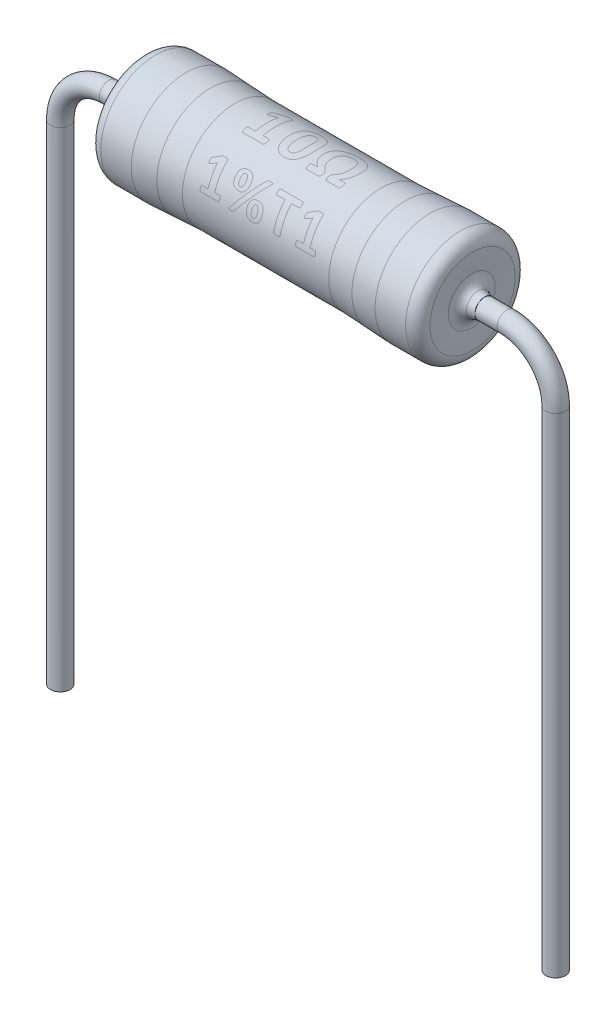
from build123d import *

# Parameters (mm, degrees)
SKETCH_WIRE_DIAMETER_R = 0.4
FILLET1_R              = 0.5
FILLET2_R              = 0.5


with BuildPart() as part:
    # SET WIRE LENGTH: sweep along a path in Sketch Wire Length
    with BuildLine(Plane.XY) as set_wire_length_path:
        Line((10.16, -22.048407346), (10.16, -2))
        ThreePointArc((10.16, -2), (9.574213562, -0.585786438), (8.16, 0))
        Line((8.16, 0), (-8.16, 0))
        ThreePointArc((-8.16, 0), (-9.574213562, -0.585786438), (-10.16, -2))
        Line((-10.16, -2), (-10.16, -22.048407346))
    # Sketch Wire Diameter → SET WIRE LENGTH (sweep)
    with BuildSketch(Plane(origin=(0, 0, 0), x_dir=(0, 0, -1), z_dir=(1, 0, 0))):
        Circle(SKETCH_WIRE_DIAMETER_R)
    sweep(path=set_wire_length_path.line)


with BuildPart() as body_2:
    # Sketch4 → Revolve1 (revolve)
    with BuildSketch(Plane.XY):
        with BuildLine():
            Line((-7.25, 0), (7.25, 0))
            Line((7.25, 0), (7.25, 0.41))
            ThreePointArc((7.25, 0.41), (6.909963237, 0.520574451), (6.7, 0.81))
            ThreePointArc((6.7, 0.81), (6.737492197, 1.30937539), (6.75, 1.81))
            Line((6.75, 1.81), (6.75, 2.25))
            Line((6.75, 2.25), (5, 2.25))
            ThreePointArc((5, 2.25), (4.49937539, 2.237492197), (4, 2.2))
            ThreePointArc((4, 2.2), (3.50062461, 2.162507803), (3, 2.15))
            Line((3, 2.15), (-3, 2.15))
            ThreePointArc((-3, 2.15), (-3.50062461, 2.162507803), (-4, 2.2))
            ThreePointArc((-4, 2.2), (-4.49937539, 2.237492197), (-5, 2.25))
            Line((-5, 2.25), (-6.75, 2.25))
            Line((-6.75, 2.25), (-6.75, 1.81))
            ThreePointArc((-6.75, 1.81), (-6.737492197, 1.30937539), (-6.7, 0.81))
            ThreePointArc((-6.7, 0.81), (-6.909963237, 0.520574451), (-7.25, 0.41))
            Line((-7.25, 0.41), (-7.25, 0))
        make_face()
    revolve(axis=Axis((-7.25, 0, 0), (1, 0, 0)))

    # Fillet1
    fillet1_edges = [body_2.edges().sort_by_distance(p)[0] for p in [
        (6.7, -0.81, 0),
        (-6.7, -0.81, 0),
    ]]
    fillet(fillet1_edges, radius=FILLET1_R)

    # Fillet2
    fillet2_edges = [body_2.edges().sort_by_distance(p)[0] for p in [
        (6.75, -2.25, 0),
        (-6.75, -2.25, 0),
    ]]
    fillet(fillet2_edges, radius=FILLET2_R)


solid = Compound([part.part, body_2.part])
